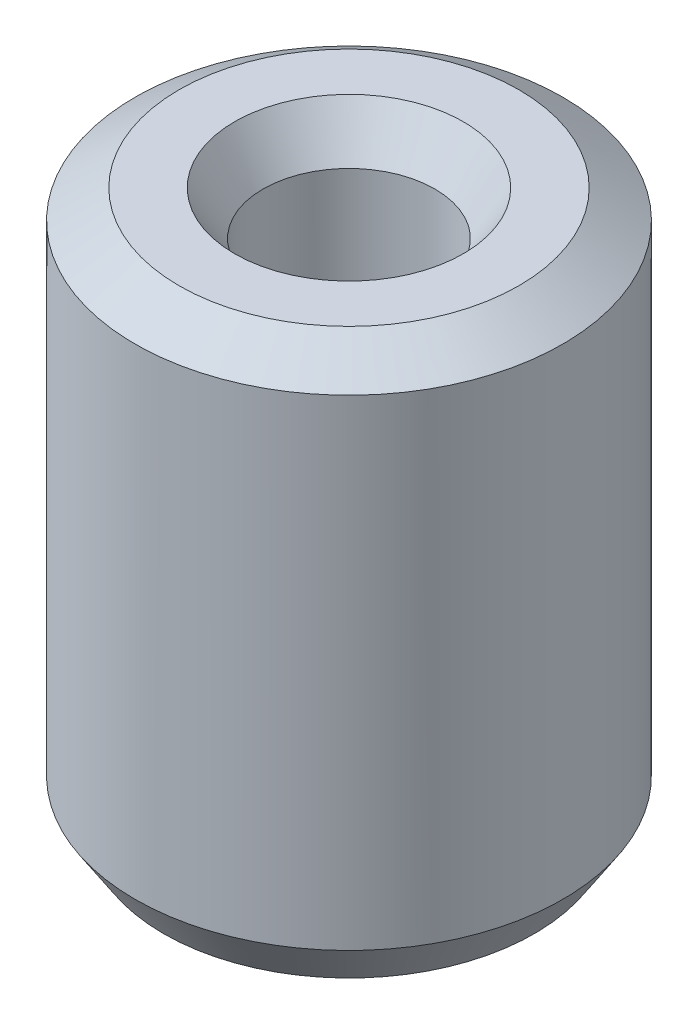
from build123d import *
from OCP.BRepFilletAPI import BRepFilletAPI_MakeChamfer

# Parameters (mm, degrees)
SKETCH1_R           = 17.5
BOSS_EXTRUDE1_DEPTH = 45.280702769
SKETCH2_R           = 7.028908512
CUT_EXTRUDE1_DEPTH  = 52.602732905
CHAMFER1_SIZE       = 2.331047982
CHAMFER1_SIZE2      = 3.602193348


with BuildPart() as part:
    # Sketch1 → Boss-Extrude1 (new body)
    with BuildSketch(Plane(origin=(0, 0, 0), x_dir=(1, 0, 0), z_dir=(0, 1, 0))):
        Circle(SKETCH1_R)
    extrude(amount=BOSS_EXTRUDE1_DEPTH)

    # Sketch2 → Cut-Extrude1 (cut, through all)
    with BuildSketch(Plane(origin=(0, 0, 0), x_dir=(1, 0, 0), z_dir=(0, 1, 0))):
        Circle(SKETCH2_R)
    extrude(amount=CUT_EXTRUDE1_DEPTH, mode=Mode.SUBTRACT)

    # Chamfer1: one chamfer whose edges measure the first distance from different faces: ONE call of the kernel's chamfer builder (chamfer() names one face for all edges)
    chamfer1_edges_1 = [part.edges().sort_by_distance(p)[0] for p in [
        (-7.028908512, 45.280702769, 0),
    ]]
    chamfer1_side_1 = [part.faces().sort_by_distance(p)[0] for p in [
        (-17.005025253, 45.280702769, 0),
    ]]
    chamfer1_edges_2 = [part.edges().sort_by_distance(p)[0] for p in [
        (-7.028908512, 0, 0),
    ]]
    chamfer1_side_2 = [part.faces().sort_by_distance(p)[0] for p in [
        (-7.028908512, 22.640351384, 0),
    ]]
    chamfer1_edges_3 = [part.edges().sort_by_distance(p)[0] for p in [
        (-17.5, 0, 0),
    ]]
    chamfer1_side_3 = [part.faces().sort_by_distance(p)[0] for p in [
        (-17.005025253, 0, 0),
    ]]
    chamfer1_edges_4 = [part.edges().sort_by_distance(p)[0] for p in [
        (-17.5, 45.280702769, 0),
    ]]
    chamfer1_side_4 = [part.faces().sort_by_distance(p)[0] for p in [
        (-17.5, 22.640351384, 0),
    ]]
    chamfer1 = BRepFilletAPI_MakeChamfer(part.part.solid().wrapped)
    for e in chamfer1_edges_1:
        chamfer1.Add(CHAMFER1_SIZE, CHAMFER1_SIZE2, e.wrapped, chamfer1_side_1[0].wrapped)  # the first distance lies on this face
    for e in chamfer1_edges_2:
        chamfer1.Add(CHAMFER1_SIZE, CHAMFER1_SIZE2, e.wrapped, chamfer1_side_2[0].wrapped)  # the first distance lies on this face
    for e in chamfer1_edges_3:
        chamfer1.Add(CHAMFER1_SIZE, CHAMFER1_SIZE2, e.wrapped, chamfer1_side_3[0].wrapped)  # the first distance lies on this face
    for e in chamfer1_edges_4:
        chamfer1.Add(CHAMFER1_SIZE, CHAMFER1_SIZE2, e.wrapped, chamfer1_side_4[0].wrapped)  # the first distance lies on this face
    add(Compound.cast(chamfer1.Shape()), mode=Mode.REPLACE)


solid = part.part
